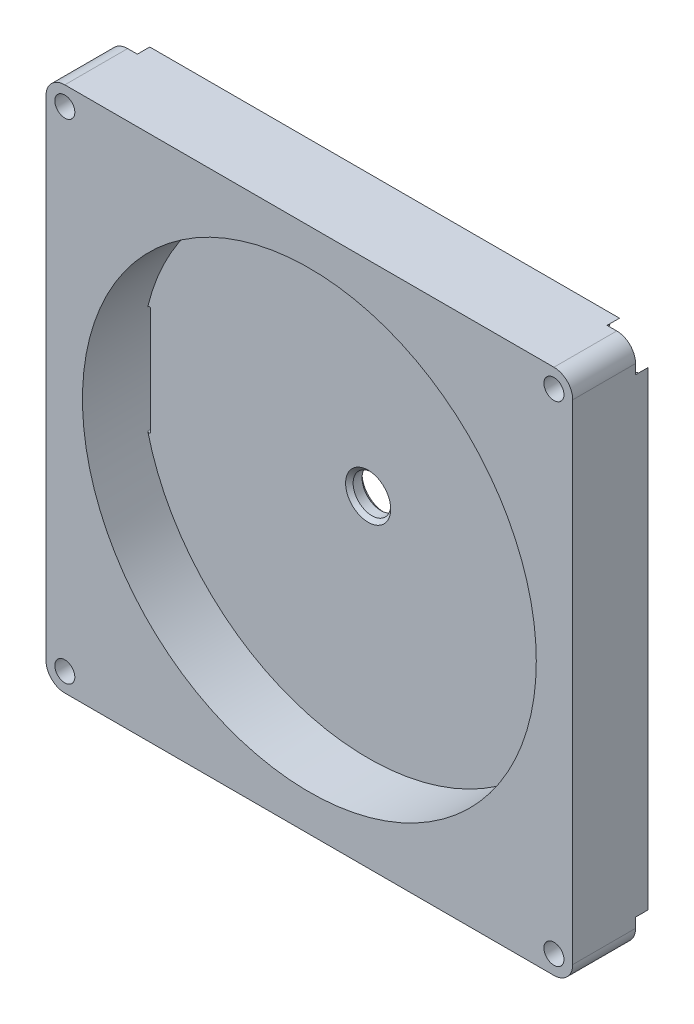
from build123d import *
from build123d.topology import SkipClean

# Parameters (mm, degrees)
SKETCH1_W                                            = 177.8
SKETCH1_H                                            = 177.8
BOSS_EXTRUDE1_DEPTH                                  = 12.7
SKETCH2_R                                            = 76.596875
CUT_EXTRUDE1_DEPTH                                   = 19.84375
SKETCH3_R                                            = 6.35
CUT_EXTRUDE2_DEPTH                                   = 19.84375
SKETCH5_W                                            = 12.7
SKETCH5_H                                            = 6.35
CUT_EXTRUDE3_DEPTH                                   = 19.84375
FILLET1_R                                            = 6.35
FILLET2_R                                            = 0.635
FILLET3_R                                            = 0.508
CHAMFER2_SIZE                                        = 1.27
FILLET5_R                                            = 0.762
CBORE_FOR_1_4_BINDING_HEAD_MACHINE_SCREW_D           = 6.7564
CBORE_FOR_1_4_BINDING_HEAD_MACHINE_SCREW_CBORE_D     = 14.2875
CBORE_FOR_1_4_BINDING_HEAD_MACHINE_SCREW_CBORE_DEPTH = 4.191


with BuildPart() as part:
    # Sketch1 → Boss-Extrude1 (new, symmetric)
    with BuildSketch(Plane.XY):
        Rectangle(SKETCH1_W, SKETCH1_H)
    extrude(amount=BOSS_EXTRUDE1_DEPTH, both=True)

    # Sketch2 → Cut-Extrude1 (cut)
    with BuildSketch(Plane.XY.offset(12.7)):
        Circle(SKETCH2_R)
    extrude(amount=-CUT_EXTRUDE1_DEPTH, mode=Mode.SUBTRACT)

    # Sketch3 → Cut-Extrude2 (cut)
    with BuildSketch(Plane.XY.offset(-7.14375)):
        Circle(SKETCH3_R)
    extrude(amount=-CUT_EXTRUDE2_DEPTH, mode=Mode.SUBTRACT)

    # Sketch5 → Cut-Extrude3 (cut)
    with SkipClean():  # the faces are left unmerged after this step: merging them gives an invalid solid
        with BuildSketch(Plane.XY.offset(-7.14375)):
            with BuildLine():
                Line((-73.421875, 21.824516747), (-73.421875, -21.824516747))
                ThreePointArc((-73.421875, -21.824516747), (-76.596875, 0), (-73.421875, 21.824516747))
            make_face()
            with Locations((0, 73.533)):
                Rectangle(SKETCH5_W, SKETCH5_H)
            with BuildLine():
                Line((63.896875, 30.068721747), (63.896875, -30.068721747))
                Line((63.896875, -30.068721747), (70.448230867, -30.068721747))
                ThreePointArc((70.448230867, -30.068721747), (76.596875, 0), (70.448230867, 30.068721747))
                Line((70.448230867, 30.068721747), (63.896875, 30.068721747))
            make_face()
        extrude(amount=-CUT_EXTRUDE3_DEPTH, mode=Mode.SUBTRACT)

    # Fillet1
    fillet1_edges = [part.edges().sort_by_distance(p)[0] for p in [
        (88.9, 88.9, 0),
        (88.9, -88.9, 0),
        (-88.9, -88.9, 0),
        (-88.9, 88.9, 0),
    ]]
    fillet(fillet1_edges, radius=FILLET1_R)

    # Fillet2
    # the kernel refuses this fillet: 0.635 mm, written as the material it adds along each edge
    with BuildSketch(Plane(origin=(-6.35, 76.708, -7.14375), x_dir=(0, -1, 0), z_dir=(0, 0, -1))) as fillet2_piece_1:
        with BuildLine():
            CenterArc((FILLET2_R, -FILLET2_R), FILLET2_R, 90, 90)
            Line((0, -FILLET2_R), (0, 0))
            Line((0, 0), (FILLET2_R, 0))
        make_face()
    extrude(amount=5.55625)
    with BuildSketch(Plane(origin=(-6.35, 70.358, -7.14375), x_dir=(0, 1, 0), z_dir=(0, 0, -1)), Plane(origin=(6.35, 76.708, -7.14375), x_dir=(0, -1, 0), z_dir=(0, 0, -1)), Plane(origin=(6.35, 70.358, -7.14375), x_dir=(-1, 0, 0), z_dir=(0, 0, -1))) as fillet2_piece_2:
        with BuildLine():
            CenterArc((FILLET2_R, FILLET2_R), FILLET2_R, 180, 90)
            Line((0, FILLET2_R), (0, 0))
            Line((0, 0), (FILLET2_R, 0))
        make_face()
    extrude(amount=5.55625)

    # Fillet3
    # the kernel refuses this fillet: 0.508 mm, written as the material it adds along each edge
    with BuildSketch(Plane(origin=(-73.421875, -21.824516747, -7.14375), x_dir=(0, 1, 0), z_dir=(0, 0, -1))) as fillet3_piece_1:
        with BuildLine():
            CenterArc((3.827559192, -0.508), FILLET3_R, 90, 166.318438428)
            ThreePointArc((3.707404249, -1.001585646), (1.847424112, -0.524031105), (0, 0))
            Line((0, 0), (3.827559192, 0))
        make_face()
    extrude(amount=5.55625)
    with BuildSketch(Plane(origin=(-73.421875, 21.824516747, -7.14375), x_dir=(0, -1, 0), z_dir=(0, 0, -1))) as fillet3_piece_2:
        with BuildLine():
            CenterArc((3.827559192, 0.508), FILLET3_R, 103.681561572, 166.318438428)
            ThreePointArc((3.707404249, 1.001585646), (1.847424112, 0.524031105), (0, 0))
            Line((0, 0), (3.827559192, 0))
        make_face()
    extrude(amount=5.55625)

    # Chamfer2
    chamfer2_edges = [part.edges().sort_by_distance(p)[0] for p in [
        (-6.35, 0, -12.7),
        (-6.35, 0, -7.14375),
    ]]
    chamfer(chamfer2_edges, length=CHAMFER2_SIZE)

    # Fillet5
    # the kernel refuses this fillet: 0.762 mm, written as the material it adds along each edge
    with BuildSketch(Plane(origin=(70.448230867, -30.068721747, -7.14375), x_dir=(-1, 0, 0), z_dir=(0, 0, -1))) as fillet5_piece_1:
        with BuildLine():
            CenterArc((0.505080189, 0.762), FILLET5_R, 202.734061429, 67.265938571)
            ThreePointArc((-0.197718896, 0.467521741), (-0.099246736, 0.233597083), (0, 0))
            Line((0, 0), (0.505080189, 0))
        make_face()
    extrude(amount=5.55625)
    with BuildSketch(Plane(origin=(63.896875, -30.068721747, -7.14375), x_dir=(1, 0, 0), z_dir=(0, 0, -1)), Plane(origin=(63.896875, 30.068721747, -7.14375), x_dir=(0, -1, 0), z_dir=(0, 0, -1))) as fillet5_piece_2:
        with BuildLine():
            CenterArc((FILLET5_R, -FILLET5_R), FILLET5_R, 90, 90)
            Line((0, -FILLET5_R), (0, 0))
            Line((0, 0), (FILLET5_R, 0))
        make_face()
    extrude(amount=5.55625)
    with BuildSketch(Plane(origin=(70.448230867, 30.068721747, -7.14375), x_dir=(-1, 0, 0), z_dir=(0, 0, -1))) as fillet5_piece_3:
        with BuildLine():
            CenterArc((0.505080189, -0.762), FILLET5_R, 90, 67.265938571)
            ThreePointArc((-0.197718896, -0.467521741), (-0.099246736, -0.233597083), (0, 0))
            Line((0, 0), (0.505080189, 0))
        make_face()
    extrude(amount=5.55625)

    # CBORE for 1/4 Binding Head Machine Screw1 (through all)
    with Locations(Plane(origin=(0, 0, -12.7), x_dir=(-1, 0, 0), z_dir=(0, 0, -1))):
        with Locations((-82.55, 82.55), (82.55, 82.55), (82.55, -82.55), (-82.55, -82.55)):
            CounterBoreHole(CBORE_FOR_1_4_BINDING_HEAD_MACHINE_SCREW_D / 2, CBORE_FOR_1_4_BINDING_HEAD_MACHINE_SCREW_CBORE_D / 2, CBORE_FOR_1_4_BINDING_HEAD_MACHINE_SCREW_CBORE_DEPTH)


solid = part.part
